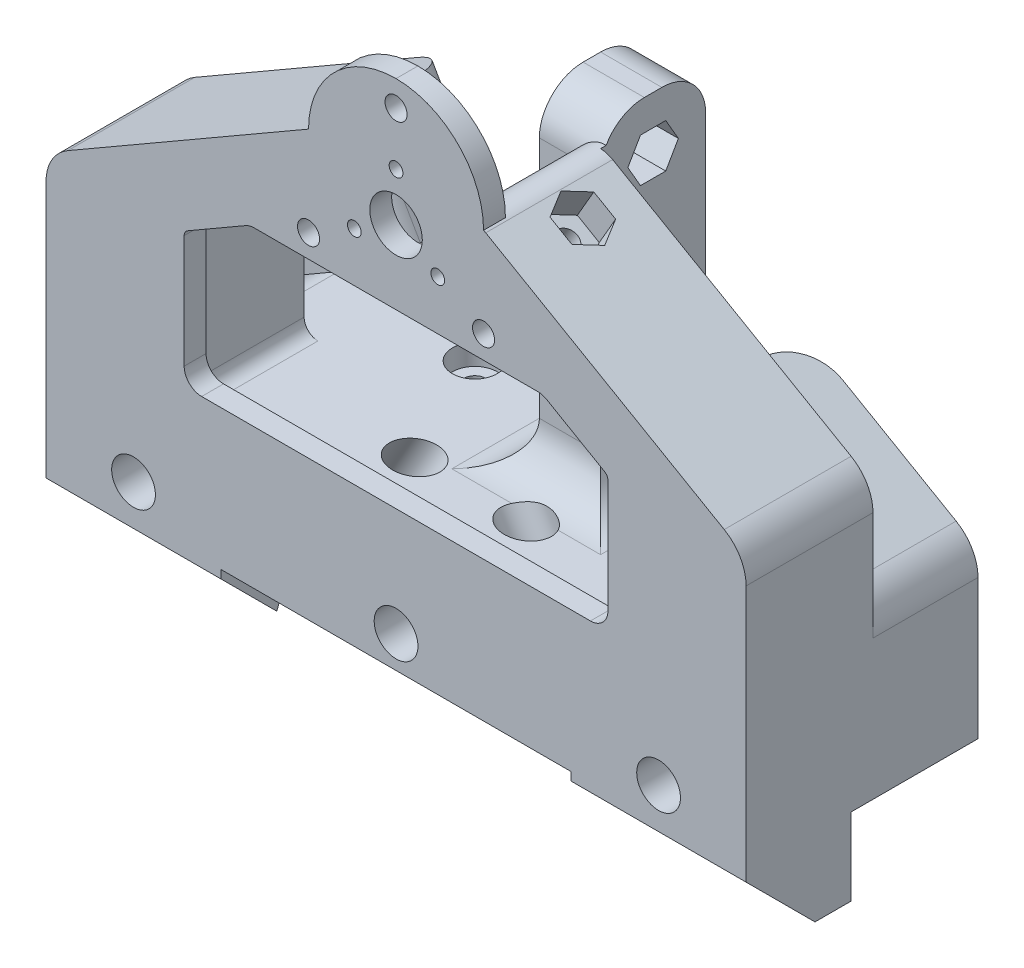
from build123d import *

# Parameters (mm, degrees)
BOSS_EXTRUDE1_DEPTH            = 15.239999999999998
SKETCH5_R                      = 1.5874999999999992
CUT_EXTRUDE2_DEPTH             = 8.89
SKETCH6_R                      = 1.5875000000000001
CUT_EXTRUDE3_DEPTH             = 8.89
CUT_EXTRUDE8_REACH             = 93.354
SKETCH11_R                     = 1.5874999999999977
SKETCH11_R_2                   = 1.5874999999999986
BOSS_EXTRUDE4_DEPTH            = 15.239999999999998
SKETCH8_R                      = 1.5874999999999986
CUT_EXTRUDE4_DEPTH             = 12.7
SKETCH9_R                      = 1.5874999999999986
CUT_EXTRUDE5_DEPTH             = 12.7
CUT_EXTRUDE9_DEPTH             = 4.7625
CUT_EXTRUDE10_DEPTH            = 4.7625
CUT_EXTRUDE11_DEPTH            = 4.7625
CUT_EXTRUDE13_DEPTH            = 4.7625
CUT_EXTRUDE16_DEPTH            = 4.7625
SKETCH23_R                     = 3.81
BOSS_EXTRUDE5_DEPTH            = 3.175
M3_CLEARANCE_HOLE1_D           = 3.2
M3_CLEARANCE_HOLE1_DEPTH       = 9.906
M3_CLEARANCE_HOLE1_TIP         = 0.9613769904440965
CUT_EXTRUDE18_REACH            = 132.345
SKETCH27_R                     = 0.9999999999999983
SKETCH27_R_2                   = 0.9999999999999831
SKETCH22_R                     = 3.1749999999999976
SKETCH22_R_2                   = 3.175000000000005
SKETCH22_R_3                   = 3.1750000000000016
CUT_EXTRUDE17_DEPTH            = 131.34523000436675
CBORE_FOR_M3_SHCS1_D           = 3.2
CBORE_FOR_M3_SHCS1_CBORE_D     = 6.5
CBORE_FOR_M3_SHCS1_CBORE_DEPTH = 3
SKETCH31_W                     = 25.39999999999999
SKETCH31_H                     = 15.239999999999995
BOSS_EXTRUDE7_DEPTH            = 11.2
FILLET10_R                     = 2
FILLET11_R                     = 6.35
SKETCH33_R                     = 3.174999999999998
CUT_EXTRUDE19_DEPTH            = 106.4973216137225
SKETCH34_R                     = 3.174999999999998
CUT_EXTRUDE20_DEPTH            = 131.17236791631467
FILLET12_R                     = 12.7
FILLET13_R                     = 3.8099999999999996
CUT_EXTRUDE21_DEPTH            = 130.56176274652648
FILLET14_R                     = 2.54
CHAMFER1_SIZE                  = 10


# Some blends are built 0.0001 mm under size
with BuildPart() as part:
    # Sketch1 → Boss-Extrude1 (new body)
    with BuildSketch(Plane.XY):
        Polygon((0, 0), (101.6, 0), (101.6, 23.933700924276287), (76.48131233866454, 38.43598200723823), (72.03631233866459, 30.737016167594547), (95.25, 17.334587347438838), (62.07125, 17.33458734743884), (62.07124999999999, 65.2726752401245), (53.18125, 65.2726752401245), (53.18125, 17.334587347438838), (6.3500000000000005, 17.33458734743884), (29.563687661335408, 30.737016167594543), (25.11868766133546, 38.43598200723823), (0, 23.933700924276277), align=None)
    extrude(amount=BOSS_EXTRUDE1_DEPTH)

    # Sketch5 → Cut-Extrude2 (cut)
    with BuildSketch(Plane(origin=(35.76359650350056, 61.94436620545653, 0), x_dir=(0, 0, -1), z_dir=(0.49999999999999467, 0.8660254037844418, 0))):
        with Locations(Location((-7.619999999999999, -54.63676839643705, 0), (0, 0, 90))):
            Circle(SKETCH5_R)
    extrude(amount=-CUT_EXTRUDE2_DEPTH, mode=Mode.SUBTRACT)

    # Sketch6 → Cut-Extrude3 (cut)
    with BuildSketch(Plane(origin=(-10.363596503501109, 17.950275693207338, 0), x_dir=(0, 0, 1), z_dir=(-0.4999999999999948, 0.8660254037844417, 0))):
        with Locations(Location((7.62, 33.35141262806222, 0), (0, 0, 270))):
            Circle(SKETCH6_R)
    extrude(amount=-CUT_EXTRUDE3_DEPTH, mode=Mode.SUBTRACT)

    # Sketch11 → Cut-Extrude8 (cut, up to next)
    with BuildSketch(Plane.ZY.offset(-62.07125), mode=Mode.PRIVATE) as cut_extrude8_sk1:
        with Locations(Location((7.619999999999999, 57.6526752401245, 0), (0, 0, 180))):
            Circle(SKETCH11_R)
    cut_extrude8_tool1 = extrude(cut_extrude8_sk1.sketch, amount=CUT_EXTRUDE8_REACH, mode=Mode.PRIVATE) & part.part
    # Sketch11 → Cut-Extrude8 (cut, up to next)
    with BuildSketch(Plane.ZY.offset(-62.07125), mode=Mode.PRIVATE) as cut_extrude8_sk2:
        with Locations(Location((7.620000000000002, 39.36073736343884, 0), (0, 0, 180))):
            Circle(SKETCH11_R_2)
    cut_extrude8_tool2 = extrude(cut_extrude8_sk2.sketch, amount=CUT_EXTRUDE8_REACH, mode=Mode.PRIVATE) & part.part
    add(cut_extrude8_tool1.solids().sort_by_distance((62.07125, 57.652675, 7.62))[0], mode=Mode.SUBTRACT)
    add(cut_extrude8_tool2.solids().sort_by_distance((62.07125, 39.360737, 7.62))[0], mode=Mode.SUBTRACT)

    # Sketch7 → Boss-Extrude4 (add)
    with BuildSketch(Plane.XY.offset(15.239999999999998)):
        Polygon((0, 0), (101.60000000000016, 1.244e-14), (101.60000000000042, 39.69825002449879), (60.514647953095114, 63.418889088530136), (56.069647953095114, 55.71992324888648), (82.55000000000042, 40.43148486636964), (82.55000000000037, 17.334587347438845), (50.80000000000008, 17.334587347438838), (19.050000000000004, 17.334587347438838), (19.050000000000004, 40.43148486636963), (45.5303520469053, 55.71992324888648), (41.0853520469053, 63.418889088530136), (0, 39.698250024498776), align=None)
    extrude(amount=BOSS_EXTRUDE4_DEPTH)

    # Sketch8 → Cut-Extrude4 (cut)
    with BuildSketch(Plane(origin=(-12.744846503501098, 22.074721678730434, 0), x_dir=(0, 0, -1), z_dir=(0.5000000000000002, -0.8660254037844385, 0))):
        with Locations(Location((-22.86, 59.67040314031204, 0), (0, 0, 90))):
            Circle(SKETCH8_R)
    extrude(amount=-CUT_EXTRUDE4_DEPTH, mode=Mode.SUBTRACT)

    # Sketch9 → Cut-Extrude5 (cut)
    with BuildSketch(Plane(origin=(38.14484650350119, 66.06881219098013, 0), x_dir=(0, 0, 1), z_dir=(-0.5, -0.8660254037844387, 0))):
        with Locations(Location((22.86, -28.31777788418729, 0), (0, 0, 270))):
            Circle(SKETCH9_R)
    extrude(amount=-CUT_EXTRUDE5_DEPTH, mode=Mode.SUBTRACT)

    # Sketch15 → Cut-Extrude9 (cut)
    with BuildSketch(Plane(origin=(42.58984650350124, 73.76777803062379, 0), x_dir=(0, 0, -1), z_dir=(0.5000000000000004, 0.8660254037844385, 0))):
        Polygon((-19.685, -26.48469077951019), (-19.685, -30.150864988864313), (-22.86, -31.983952093541372), (-26.035000000000004, -30.15086498886431), (-26.035000000000004, -26.48469077951019), (-22.86, -24.651603674833126), align=None)
    extrude(amount=-CUT_EXTRUDE9_DEPTH, mode=Mode.SUBTRACT)

    # Sketch16 → Cut-Extrude10 (cut)
    with BuildSketch(Plane(origin=(31.31859650350064, 54.24540036581284, 0), x_dir=(0, 0, -1), z_dir=(0.4999999999999949, 0.8660254037844417, 0))):
        Polygon((-4.445000000000004, -52.803681291759986), (-4.445000000000004, -56.46985550111411), (-7.619999999999999, -58.30294260579117), (-10.794999999999996, -56.46985550111411), (-10.794999999999996, -52.803681291759986), (-7.619999999999999, -50.97059418708293), align=None)
    extrude(amount=CUT_EXTRUDE10_DEPTH, mode=Mode.SUBTRACT)

    # Sketch17 → Cut-Extrude11 (cut)
    with BuildSketch(Plane(origin=(-5.9185965035011545, 10.251309853563654, 18.861690463744978), x_dir=(-0.2961981327260284, -0.17101007166283463, 0.9396926207859069), z_dir=(-0.4999999999999949, 0.8660254037844417, 0))):
        Polygon((-18.795588501103953, 29.32827886042014), (-18.795588501103953, 25.66210465106602), (-21.97058850110395, 23.82901754638896), (-25.145588501103948, 25.66210465106602), (-25.145588501103948, 29.32827886042014), (-21.97058850110395, 31.161365965097204), align=None)
    extrude(amount=CUT_EXTRUDE11_DEPTH, mode=Mode.SUBTRACT)

    # Sketch20 → Cut-Extrude13 (cut)
    with BuildSketch(Plane(origin=(62.07125, 8.98e-15, -63.5), x_dir=(0, 0, 1), z_dir=(-1, -1.4e-16, 0))):
        Polygon((74.78617420935413, 39.36073736343885), (72.95308710467704, 36.18573736343886), (69.28691289532296, 36.18573736343886), (67.45382579064588, 39.36073736343884), (69.28691289532291, 42.53573736343882), (72.95308710467704, 42.53573736343882), align=None)
        Polygon((74.78617420935413, 57.652675240124516), (72.95308710467704, 54.477675240124526), (69.28691289532296, 54.477675240124526), (67.45382579064588, 57.6526752401245), (69.28691289532291, 60.827675240124485), (72.95308710467704, 60.827675240124485), align=None)
    extrude(amount=CUT_EXTRUDE13_DEPTH, mode=Mode.SUBTRACT)

    # Sketch21 → Cut-Extrude16 (cut)
    with BuildSketch(Plane(origin=(-66.09980165744878, 1.5355117441898172, 0), x_dir=(0.8660254037844384, 0.5000000000000006, 0), z_dir=(0.5000000000000006, -0.8660254037844384, 0))):
        Polygon((119.32175468868053, 24.693087104677048), (119.32175468868053, 21.02691289532295), (116.14675468868049, 19.193825790645906), (112.97175468868052, 21.02691289532295), (112.97175468868052, 24.693087104677048), (116.14675468868049, 26.526174209354096), align=None)
    extrude(amount=CUT_EXTRUDE16_DEPTH, mode=Mode.SUBTRACT)

    # Sketch23 → Boss-Extrude5 (add)
    with BuildSketch(Plane.XY.offset(30.479999999999997)):
        Polygon((38.10000000000023, 61.69529528062369), (0, 39.69825002449881), (0, 7.78e-15), (101.6, 1.244e-14), (101.60000000000016, 39.69825002449895), (63.50000000000022, 61.695295280623654), (63.500000000000206, 74.3952952806237), (38.10000000000022, 74.39529528062369), align=None)
        with Locations((50.80000000000019, 56.01272525612479)):
            Circle(SKETCH23_R, mode=Mode.SUBTRACT)
    extrude(amount=BOSS_EXTRUDE5_DEPTH)

    # M3 Clearance Hole1
    with Locations(Plane.XY.offset(33.654999999999994)):
        with Locations((38.1, 48.680376837), (63.5, 48.680376837), (50.8, 70.677422094)):
            Hole(M3_CLEARANCE_HOLE1_D / 2, depth=M3_CLEARANCE_HOLE1_DEPTH)
            with Locations((0, 0, -(M3_CLEARANCE_HOLE1_DEPTH + M3_CLEARANCE_HOLE1_TIP / 2))):  # 118° drill point
                Cone(0, M3_CLEARANCE_HOLE1_D / 2, M3_CLEARANCE_HOLE1_TIP, mode=Mode.SUBTRACT)

    # Sketch27 → Cut-Extrude18 (cut, up to next)
    with BuildSketch(Plane.XY.offset(33.654999999999994), mode=Mode.PRIVATE) as cut_extrude18_sk1:
        with Locations((44.750812554565925, 52.52022525612478)):
            Circle(SKETCH27_R)
    cut_extrude18_tool1 = extrude(cut_extrude18_sk1.sketch, amount=-CUT_EXTRUDE18_REACH, mode=Mode.PRIVATE) & part.part
    # Sketch27 → Cut-Extrude18 (cut, up to next)
    with BuildSketch(Plane.XY.offset(33.654999999999994), mode=Mode.PRIVATE) as cut_extrude18_sk2:
        with Locations((56.849187445434474, 52.520225256124796)):
            Circle(SKETCH27_R_2)
    cut_extrude18_tool2 = extrude(cut_extrude18_sk2.sketch, amount=-CUT_EXTRUDE18_REACH, mode=Mode.PRIVATE) & part.part
    # Sketch27 → Cut-Extrude18 (cut, up to next)
    with BuildSketch(Plane.XY.offset(33.654999999999994), mode=Mode.PRIVATE) as cut_extrude18_sk3:
        with Locations((50.8000000000002, 62.99772525612477)):
            Circle(SKETCH27_R)
    cut_extrude18_tool3 = extrude(cut_extrude18_sk3.sketch, amount=-CUT_EXTRUDE18_REACH, mode=Mode.PRIVATE) & part.part
    add(cut_extrude18_tool1.solids().sort_by_distance((44.750813, 52.520225, 33.655))[0], mode=Mode.SUBTRACT)
    add(cut_extrude18_tool2.solids().sort_by_distance((56.849187, 52.520225, 33.655))[0], mode=Mode.SUBTRACT)
    add(cut_extrude18_tool3.solids().sort_by_distance((50.8, 62.997725, 33.655))[0], mode=Mode.SUBTRACT)

    # Sketch22 → Cut-Extrude17 (cut, through all)
    with BuildSketch(Plane(origin=(0, 0, 0), x_dir=(-1, 0, 0), z_dir=(0, 0, -1))):
        with Locations((-88.9, 4.634587347438833)):
            Circle(SKETCH22_R)
        with Locations((-50.8, 4.6345873474388375)):
            Circle(SKETCH22_R_2)
        with Locations((-12.699999999999989, 4.6345873474388375)):
            Circle(SKETCH22_R_3)
    extrude(amount=-CUT_EXTRUDE17_DEPTH, mode=Mode.SUBTRACT)

    # CBORE for M3 SHCS1 (through all)
    with Locations(Plane(origin=(-15.72574093086107, 17.334587347438827, 0.8913153010314027), x_dir=(1, -7e-17, 0), z_dir=(7e-17, 1, 0))):
        with Locations((82.400740931, -5.458684699), (50.650740931, -5.458684699)):
            CounterBoreHole(CBORE_FOR_M3_SHCS1_D / 2, CBORE_FOR_M3_SHCS1_CBORE_D / 2, CBORE_FOR_M3_SHCS1_CBORE_DEPTH)

    # Sketch31 → Boss-Extrude7 (add)
    with BuildSketch(Plane.XZ):
        Polygon((0, 33.654999999999994), (25.4, 33.654999999999994), (25.4, 18.415), (1.56e-15, 18.415), align=None)
        with Locations((88.89999999999998, 26.034999999999997)):
            Rectangle(SKETCH31_W, SKETCH31_H)
    extrude(amount=BOSS_EXTRUDE7_DEPTH)

    # Fillet10
    fillet10_edges = [part.edges().sort_by_distance(p)[0] for p in [
        (82.55000000000042, 40.43148486636964, 22.86),
        (19.050000000000004, 40.43148486636963, 22.86),
        (50.80000000000018, 17.33458734743884, 30.479999999999997),
        (19.050000000000004, 17.334587347438838, 22.86),
        (82.55000000000037, 17.334587347438845, 22.86),
        (95.25, 17.334587347438838, 7.619999999999999),
        (6.3500000000000005, 17.33458734743884, 7.619999999999999),
    ]]
    fillet(fillet10_edges, radius=FILLET10_R)

    # Fillet11
    # the kernel refuses this fillet: 6.35 mm, written as the material it adds along each edge
    with BuildSketch(Plane(origin=(62.07125, 17.33458734743884, 15.239999999999998), x_dir=(0, 0, 1), z_dir=(-1, -1.1e-16, 0))) as fillet11_piece_1:
        with BuildLine():
            CenterArc((FILLET11_R, FILLET11_R), FILLET11_R, 180.00000000000003, 90)
            Line((-1.78e-15, FILLET11_R), (-FILLET11_R * 0.02, FILLET11_R))
            Line((-FILLET11_R * 0.02, FILLET11_R), (-FILLET11_R * 0.02, -FILLET11_R * 0.02))
            Line((-FILLET11_R * 0.02, -FILLET11_R * 0.02), (FILLET11_R, -FILLET11_R * 0.02))
            Line((FILLET11_R, -FILLET11_R * 0.02), (FILLET11_R, 0))
        make_face()
    extrude(amount=8.89)
    with BuildSketch(Plane(origin=(53.18125, 17.334587347438838, 0), x_dir=(-1, 5.6e-16, 0), z_dir=(0, 0, 1))) as fillet11_piece_2:
        with BuildLine():
            CenterArc((FILLET11_R, -FILLET11_R), FILLET11_R, 90.00000000000004, 89.99999999999993)
            Line((3.55e-15, -FILLET11_R), (-FILLET11_R * 0.02, -FILLET11_R))
            Line((-FILLET11_R * 0.02, -FILLET11_R), (-FILLET11_R * 0.02, FILLET11_R * 0.02))
            Line((-FILLET11_R * 0.02, FILLET11_R * 0.02), (FILLET11_R, FILLET11_R * 0.02))
            Line((FILLET11_R, FILLET11_R * 0.02), (FILLET11_R, 0))
        make_face()
    extrude(amount=15.239999999999998)
    with BuildSketch(Plane(origin=(62.07125, 17.33458734743884, 0), x_dir=(1, 0, 0), z_dir=(0, 0, 1))) as fillet11_piece_3_section:
        with BuildLine():
            CenterArc((FILLET11_R, FILLET11_R), FILLET11_R, 180.00000000000003, 90)
            Line((0, FILLET11_R), (-FILLET11_R * 0.02, FILLET11_R))
            Line((-FILLET11_R * 0.02, FILLET11_R), (-FILLET11_R * 0.02, -FILLET11_R * 0.02))
            Line((-FILLET11_R * 0.02, -FILLET11_R * 0.02), (FILLET11_R, -FILLET11_R * 0.02))
            Line((FILLET11_R, -FILLET11_R * 0.02), (FILLET11_R, 0))
        make_face()
    fillet11_piece_3 = extrude(amount=15.239999999999998, mode=Mode.PRIVATE)
    fillet11_piece_3 = fillet11_piece_3 - Plane(origin=(66.67500000013894, 18.910593055756184, 6.350000000031403), x_dir=(1, -7e-17, 0), z_dir=(7e-17, 1, 0)) * Cylinder(3.25, 56, mode=Mode.PRIVATE)
    add(fillet11_piece_3)
    with BuildSketch(Plane(origin=(77.94624999999999, 17.33458734743884, 15.239999999999998), x_dir=(0, 0, 1), z_dir=(-1, -1.1e-16, 0))) as fillet11_piece_4a_section:
        with BuildLine():
            CenterArc((FILLET11_R, FILLET11_R), FILLET11_R, 180.00000000000003, 90)
            Line((-1.78e-15, FILLET11_R), (-FILLET11_R * 0.02, FILLET11_R))
            Line((-FILLET11_R * 0.02, FILLET11_R), (-FILLET11_R * 0.02, -FILLET11_R * 0.02))
            Line((-FILLET11_R * 0.02, -FILLET11_R * 0.02), (FILLET11_R, -FILLET11_R * 0.02))
            Line((FILLET11_R, -FILLET11_R * 0.02), (FILLET11_R, 0))
        make_face()
    fillet11_piece_4a = extrude(amount=24.764999999999993, mode=Mode.PRIVATE)
    fillet11_piece_4a = split(fillet11_piece_4a, bisect_by=Plane(origin=(62.07125, 18.77219632303319, 16.677608975594335), z_dir=(1, 1.5e-16, 0)), keep=Keep.TOP, mode=Mode.PRIVATE)
    with BuildSketch(Plane(origin=(62.07125, 17.33458734743884, 0), x_dir=(1, 0, 0), z_dir=(0, 0, 1))) as fillet11_piece_4b_section:
        with BuildLine():
            CenterArc((FILLET11_R, FILLET11_R), FILLET11_R, 180.00000000000003, 90)
            Line((0, FILLET11_R), (-FILLET11_R * 0.02, FILLET11_R))
            Line((-FILLET11_R * 0.02, FILLET11_R), (-FILLET11_R * 0.02, -FILLET11_R * 0.02))
            Line((-FILLET11_R * 0.02, -FILLET11_R * 0.02), (FILLET11_R, -FILLET11_R * 0.02))
            Line((FILLET11_R, -FILLET11_R * 0.02), (FILLET11_R, 0))
        make_face()
    fillet11_piece_4b = extrude(amount=31.115000000000002, mode=Mode.PRIVATE)
    fillet11_piece_4b = split(fillet11_piece_4b, bisect_by=Plane(origin=(63.50885897559436, 18.772196323033185, 15.239999999999998), z_dir=(0, 0, 1)), keep=Keep.TOP, mode=Mode.PRIVATE)
    fillet11_piece_4 = fillet11_piece_4a & fillet11_piece_4b
    add(fillet11_piece_4)
    with BuildSketch(Plane(origin=(53.18125, 17.334587347438838, 0), x_dir=(-1, 5.6e-16, 0), z_dir=(0, 0, 1))) as fillet11_piece_5a_section:
        with BuildLine():
            CenterArc((FILLET11_R, -FILLET11_R), FILLET11_R, 90.00000000000004, 89.99999999999993)
            Line((3.55e-15, -FILLET11_R), (-FILLET11_R * 0.02, -FILLET11_R))
            Line((-FILLET11_R * 0.02, -FILLET11_R), (-FILLET11_R * 0.02, FILLET11_R * 0.02))
            Line((-FILLET11_R * 0.02, FILLET11_R * 0.02), (FILLET11_R, FILLET11_R * 0.02))
            Line((FILLET11_R, FILLET11_R * 0.02), (FILLET11_R, 0))
        make_face()
    fillet11_piece_5a = extrude(amount=31.115000000000002, mode=Mode.PRIVATE)
    fillet11_piece_5a = split(fillet11_piece_5a, bisect_by=Plane(origin=(51.74364102440566, 18.772196323033185, 15.239999999999998), z_dir=(0, 0, 1)), keep=Keep.TOP, mode=Mode.PRIVATE)
    with BuildSketch(Plane(origin=(62.07125, 17.33458734743884, 15.239999999999998), x_dir=(0, 0, 1), z_dir=(-1, -1.1e-16, 0))) as fillet11_piece_5b_section:
        with BuildLine():
            CenterArc((FILLET11_R, FILLET11_R), FILLET11_R, 180.00000000000003, 90)
            Line((-1.78e-15, FILLET11_R), (-FILLET11_R * 0.02, FILLET11_R))
            Line((-FILLET11_R * 0.02, FILLET11_R), (-FILLET11_R * 0.02, -FILLET11_R * 0.02))
            Line((-FILLET11_R * 0.02, -FILLET11_R * 0.02), (FILLET11_R, -FILLET11_R * 0.02))
            Line((FILLET11_R, -FILLET11_R * 0.02), (FILLET11_R, 0))
        make_face()
    fillet11_piece_5b = extrude(amount=24.764999999999993, mode=Mode.PRIVATE)
    fillet11_piece_5b = split(fillet11_piece_5b, bisect_by=Plane(origin=(53.18125, 18.772196323033185, 16.67760897559434), z_dir=(-1, 0, 0)), keep=Keep.TOP, mode=Mode.PRIVATE)
    fillet11_piece_5 = fillet11_piece_5a & fillet11_piece_5b
    add(fillet11_piece_5)
    # the kernel refuses this fillet: 6.35 mm, written as the material it takes off along each edge
    with BuildSketch(Plane(origin=(45.5303520469053, 55.71992324888648, 15.239999999999998), x_dir=(-0.8660254037844384, -0.5000000000000003, 0), z_dir=(-0.5000000000000003, 0.8660254037844386, 0))) as fillet11_2_piece_1:
        with BuildLine():
            CenterArc((FILLET11_R, FILLET11_R), FILLET11_R, 180, 90)
            Line((-1.78e-15, FILLET11_R), (-FILLET11_R * 0.02, FILLET11_R))
            Line((-FILLET11_R * 0.02, FILLET11_R), (-FILLET11_R * 0.02, -FILLET11_R * 0.02))
            Line((-FILLET11_R * 0.02, -FILLET11_R * 0.02), (FILLET11_R, -FILLET11_R * 0.02))
            Line((FILLET11_R, -FILLET11_R * 0.02), (FILLET11_R, 0))
        make_face()
    extrude(amount=8.889999999999997, mode=Mode.SUBTRACT)
    with BuildSketch(Plane(origin=(76.48131233866454, 38.43598200723823, 15.239999999999998), x_dir=(0, 0, -1), z_dir=(-0.4999999999999947, -0.8660254037844418, 0))) as fillet11_2_piece_2:
        with BuildLine():
            CenterArc((FILLET11_R, FILLET11_R), FILLET11_R, 180, 90)
            Line((-1.78e-15, FILLET11_R), (-FILLET11_R * 0.02, FILLET11_R))
            Line((-FILLET11_R * 0.02, FILLET11_R), (-FILLET11_R * 0.02, -FILLET11_R * 0.02))
            Line((-FILLET11_R * 0.02, -FILLET11_R * 0.02), (FILLET11_R, -FILLET11_R * 0.02))
            Line((FILLET11_R, -FILLET11_R * 0.02), (FILLET11_R, 0))
        make_face()
    extrude(amount=8.889999999999997, mode=Mode.SUBTRACT)
    with BuildSketch(Plane(origin=(29.563687661335408, 30.737016167594543, 15.239999999999998), x_dir=(0, 0, -1), z_dir=(-0.4999999999999942, 0.866025403784442, 0))) as fillet11_2_piece_3:
        with BuildLine():
            CenterArc((FILLET11_R, FILLET11_R), FILLET11_R, 180.00000000000003, 90)
            Line((-1.78e-15, FILLET11_R), (-FILLET11_R * 0.02, FILLET11_R))
            Line((-FILLET11_R * 0.02, FILLET11_R), (-FILLET11_R * 0.02, -FILLET11_R * 0.02))
            Line((-FILLET11_R * 0.02, -FILLET11_R * 0.02), (FILLET11_R, -FILLET11_R * 0.02))
            Line((FILLET11_R, -FILLET11_R * 0.02), (FILLET11_R, 0))
        make_face()
    extrude(amount=8.889999999999997, mode=Mode.SUBTRACT)
    with BuildSketch(Plane(origin=(29.563687661335408, 30.737016167594543, 0), x_dir=(0, 0, 1), z_dir=(-0.4999999999999942, 0.866025403784442, 0))) as fillet11_2_piece_4:
        with BuildLine():
            CenterArc((FILLET11_R, -FILLET11_R), FILLET11_R, 90, 89.99999999999997)
            Line((-8.9e-16, -FILLET11_R), (-FILLET11_R * 0.02, -FILLET11_R))
            Line((-FILLET11_R * 0.02, -FILLET11_R), (-FILLET11_R * 0.02, FILLET11_R * 0.02))
            Line((-FILLET11_R * 0.02, FILLET11_R * 0.02), (FILLET11_R, FILLET11_R * 0.02))
            Line((FILLET11_R, FILLET11_R * 0.02), (FILLET11_R, 0))
        make_face()
    extrude(amount=8.889999999999997, mode=Mode.SUBTRACT)
    with BuildSketch(Plane(origin=(76.48131233866454, 38.43598200723823, 0), x_dir=(0, 0, 1), z_dir=(-0.4999999999999947, -0.8660254037844418, 0))) as fillet11_2_piece_5:
        with BuildLine():
            CenterArc((FILLET11_R, -FILLET11_R), FILLET11_R, 90, 90)
            Line((-8.9e-16, -FILLET11_R), (-FILLET11_R * 0.02, -FILLET11_R))
            Line((-FILLET11_R * 0.02, -FILLET11_R), (-FILLET11_R * 0.02, FILLET11_R * 0.02))
            Line((-FILLET11_R * 0.02, FILLET11_R * 0.02), (FILLET11_R, FILLET11_R * 0.02))
            Line((FILLET11_R, FILLET11_R * 0.02), (FILLET11_R, 0))
        make_face()
    extrude(amount=8.889999999999997, mode=Mode.SUBTRACT)
    with BuildSketch(Plane(origin=(101.60000000000042, 39.69825002449879, 15.239999999999998), x_dir=(-0.8660254037844375, 0.5000000000000022, -1.627396157507454e-14), z_dir=(-1.389e-14, 8.49e-15, 1))) as fillet11_2_piece_6:
        with BuildLine():
            CenterArc((FILLET11_R * 0.57735026919, FILLET11_R), FILLET11_R, 210.0000000000002, 60)
            Line((-FILLET11_R * 0.288675134595, FILLET11_R * 0.5), (-FILLET11_R * 0.305995642671, FILLET11_R * 0.49))
            Line((-FILLET11_R * 0.305995642671, FILLET11_R * 0.49), (-FILLET11_R * 0.0115470053838, -FILLET11_R * 0.02))
            Line((-FILLET11_R * 0.0115470053838, -FILLET11_R * 0.02), (FILLET11_R * 0.57735026919, -FILLET11_R * 0.02))
            Line((FILLET11_R * 0.57735026919, -FILLET11_R * 0.02), (FILLET11_R * 0.57735026919, 1.2e-16))
        make_face()
    extrude(amount=18.414999999999996, mode=Mode.SUBTRACT)
    with BuildSketch(Plane(origin=(101.6, 23.933700924276287, 0), x_dir=(-0.8660254037844423, 0.4999999999999938, 0), z_dir=(0, 0, 1))) as fillet11_2_piece_7:
        with BuildLine():
            CenterArc((FILLET11_R * 0.57735026919, FILLET11_R), FILLET11_R, 209.99999999999952, 60.0000000000004)
            Line((-FILLET11_R * 0.288675134595, FILLET11_R * 0.5), (-FILLET11_R * 0.30599564267, FILLET11_R * 0.49))
            Line((-FILLET11_R * 0.30599564267, FILLET11_R * 0.49), (-FILLET11_R * 0.0115470053838, -FILLET11_R * 0.02))
            Line((-FILLET11_R * 0.0115470053838, -FILLET11_R * 0.02), (FILLET11_R * 0.57735026919, -FILLET11_R * 0.02))
            Line((FILLET11_R * 0.57735026919, -FILLET11_R * 0.02), (FILLET11_R * 0.57735026919, 2e-17))
        make_face()
    extrude(amount=15.239999999999998, mode=Mode.SUBTRACT)
    with BuildSketch(Plane(origin=(0, 23.933700924276277, 0), x_dir=(0.8660254037844417, 0.4999999999999948, 0), z_dir=(0, 0, 1))) as fillet11_2_piece_8:
        with BuildLine():
            CenterArc((FILLET11_R * 0.57735026919, -FILLET11_R), FILLET11_R, 89.99999999999999, 60.000000000000384)
            Line((-FILLET11_R * 0.288675134595, -FILLET11_R * 0.5), (-FILLET11_R * 0.305995642671, -FILLET11_R * 0.49))
            Line((-FILLET11_R * 0.305995642671, -FILLET11_R * 0.49), (-FILLET11_R * 0.0115470053838, FILLET11_R * 0.02))
            Line((-FILLET11_R * 0.0115470053838, FILLET11_R * 0.02), (FILLET11_R * 0.57735026919, FILLET11_R * 0.02))
            Line((FILLET11_R * 0.57735026919, FILLET11_R * 0.02), (FILLET11_R * 0.57735026919, 1.3e-16))
        make_face()
    extrude(amount=15.239999999999998, mode=Mode.SUBTRACT)
    with BuildSketch(Plane(origin=(0, 39.69825002449881, 33.654999999999994), x_dir=(0.8660254037844423, 0.4999999999999938, 0), z_dir=(0, -1.93e-15, -1))) as fillet11_2_piece_9:
        with BuildLine():
            CenterArc((FILLET11_R * 0.57735026919, FILLET11_R), FILLET11_R, 209.9999999999998, 59.999999999999716)
            Line((-FILLET11_R * 0.288675134595, FILLET11_R * 0.5), (-FILLET11_R * 0.30599564267, FILLET11_R * 0.49))
            Line((-FILLET11_R * 0.30599564267, FILLET11_R * 0.49), (-FILLET11_R * 0.0115470053838, -FILLET11_R * 0.02))
            Line((-FILLET11_R * 0.0115470053838, -FILLET11_R * 0.02), (FILLET11_R * 0.57735026919, -FILLET11_R * 0.02))
            Line((FILLET11_R * 0.57735026919, -FILLET11_R * 0.02), (FILLET11_R * 0.57735026919, 5e-17))
        make_face()
    extrude(amount=18.414999999999996, mode=Mode.SUBTRACT)
    with BuildSketch(Plane(origin=(62.07124999999999, 65.2726752401245, 15.239999999999998), x_dir=(0, -1, 0), z_dir=(-1, 0, 0))) as fillet11_2_piece_10_section:
        with BuildLine():
            CenterArc((FILLET11_R, -FILLET11_R), FILLET11_R, 90, 90)
            Line((0, -FILLET11_R), (-FILLET11_R * 0.02, -FILLET11_R))
            Line((-FILLET11_R * 0.02, -FILLET11_R), (-FILLET11_R * 0.02, FILLET11_R * 0.02))
            Line((-FILLET11_R * 0.02, FILLET11_R * 0.02), (FILLET11_R, FILLET11_R * 0.02))
            Line((FILLET11_R, FILLET11_R * 0.02), (FILLET11_R, 0))
        make_face()
    fillet11_2_piece_10 = extrude(amount=8.889999999999993, mode=Mode.PRIVATE)
    fillet11_2_piece_10 = split(fillet11_2_piece_10, bisect_by=Plane(origin=(61.11156527313953, 64.45278021476493, 13.74111960618633), z_dir=(0.8660254037844387, -0.5000000000000003, 0)), keep=Keep.TOP, mode=Mode.PRIVATE)
    fillet11_2_piece_10 = split(fillet11_2_piece_10, bisect_by=Plane(origin=(60.97046730003426, 63.15572166587298, 13.74111960618633), z_dir=(0.5000000000000004, 0.8660254037844385, 0)), keep=Keep.TOP, mode=Mode.PRIVATE)
    add(fillet11_2_piece_10, mode=Mode.SUBTRACT)
    with BuildSketch(Plane(origin=(62.07124999999999, 65.2726752401245, 15.239999999999998), x_dir=(0, -1, 0), z_dir=(-1, 0, 0))) as fillet11_2_piece_11_section:
        with BuildLine():
            CenterArc((FILLET11_R, -FILLET11_R), FILLET11_R, 90, 90)
            Line((0, -FILLET11_R), (-FILLET11_R * 0.02, -FILLET11_R))
            Line((-FILLET11_R * 0.02, -FILLET11_R), (-FILLET11_R * 0.02, FILLET11_R * 0.02))
            Line((-FILLET11_R * 0.02, FILLET11_R * 0.02), (FILLET11_R, FILLET11_R * 0.02))
            Line((FILLET11_R, FILLET11_R * 0.02), (FILLET11_R, 0))
        make_face()
    fillet11_2_piece_11 = extrude(amount=8.889999999999993, mode=Mode.PRIVATE)
    fillet11_2_piece_11 = split(fillet11_2_piece_11, bisect_by=Plane(origin=(60.93331882659865, 64.14404831308751, 13.043766637271109), z_dir=(-0.8660254037844387, 0.5000000000000003, 0)), keep=Keep.TOP, mode=Mode.PRIVATE)
    fillet11_2_piece_11 = split(fillet11_2_piece_11, bisect_by=Plane(origin=(59.258635332500496, 64.14404831313601, 13.043766637271109), z_dir=(0.5000000000000004, 0.8660254037844385, 0)), keep=Keep.TOP, mode=Mode.PRIVATE)
    add(fillet11_2_piece_11, mode=Mode.SUBTRACT)
    with BuildSketch(Plane(origin=(62.07124999999999, 65.2726752401245, 15.239999999999998), x_dir=(0, -1, 0), z_dir=(-1, 0, 0))) as fillet11_2_piece_12_section:
        with BuildLine():
            CenterArc((FILLET11_R, -FILLET11_R), FILLET11_R, 90, 90)
            Line((0, -FILLET11_R), (-FILLET11_R * 0.02, -FILLET11_R))
            Line((-FILLET11_R * 0.02, -FILLET11_R), (-FILLET11_R * 0.02, FILLET11_R * 0.02))
            Line((-FILLET11_R * 0.02, FILLET11_R * 0.02), (FILLET11_R, FILLET11_R * 0.02))
            Line((FILLET11_R, FILLET11_R * 0.02), (FILLET11_R, 0))
        make_face()
    fillet11_2_piece_12 = extrude(amount=8.889999999999993, mode=Mode.PRIVATE)
    fillet11_2_piece_12 = split(fillet11_2_piece_12, bisect_by=Plane(origin=(59.530986221783294, 61.715136992436896, 13.941728419206664), z_dir=(-0.8660254037844387, 0.5000000000000003, 0)), keep=Keep.TOP, mode=Mode.PRIVATE)
    fillet11_2_piece_12 = split(fillet11_2_piece_12, bisect_by=Plane(origin=(57.10765314605843, 65.38591845750042, 13.941728419206664), z_dir=(-0.5000000000000004, -0.8660254037844385, 0)), keep=Keep.TOP, mode=Mode.PRIVATE)
    add(fillet11_2_piece_12, mode=Mode.SUBTRACT)
    with BuildSketch(Plane(origin=(62.07124999999999, 65.2726752401245, 0), x_dir=(0, 0, 1), z_dir=(-1, 0, 0))) as fillet11_2_piece_13:
        with BuildLine():
            CenterArc((FILLET11_R, -FILLET11_R), FILLET11_R, 90, 90)
            Line((-8.9e-16, -FILLET11_R), (-FILLET11_R * 0.02, -FILLET11_R))
            Line((-FILLET11_R * 0.02, -FILLET11_R), (-FILLET11_R * 0.02, FILLET11_R * 0.02))
            Line((-FILLET11_R * 0.02, FILLET11_R * 0.02), (FILLET11_R, FILLET11_R * 0.02))
            Line((FILLET11_R, FILLET11_R * 0.02), (FILLET11_R, 0))
        make_face()
    extrude(amount=8.889999999999993, mode=Mode.SUBTRACT)

    # Sketch33 → Cut-Extrude19 (cut, through all)
    with BuildSketch(Plane(origin=(38.144846503501185, 66.06881219098011, 0), x_dir=(0.8660254037844386, -0.4999999999999999, 0), z_dir=(-0.49999999999999994, -0.8660254037844387, 0))):
        with Locations((28.3177778841873, 22.86)):
            Circle(SKETCH33_R)
    extrude(amount=CUT_EXTRUDE19_DEPTH, mode=Mode.SUBTRACT)

    # Sketch34 → Cut-Extrude20 (cut, through all)
    with BuildSketch(Plane(origin=(-12.7448465035011, 22.074721678730437, 0), x_dir=(0.8660254037844385, 0.5000000000000004, 0), z_dir=(0.5000000000000003, -0.8660254037844384, 0))):
        with Locations(Location((59.670403140312054, 22.86, 0), (0, 0, 180))):
            Circle(SKETCH34_R)
    extrude(amount=CUT_EXTRUDE20_DEPTH, mode=Mode.SUBTRACT)

    # Fillet12
    fillet12_edges = [part.edges().sort_by_distance(p)[0] for p in [
        (38.10000000000022, 74.39529528062369, 32.067499999999995),
        (63.500000000000206, 74.3952952806237, 32.067499999999995),
    ]]
    fillet(fillet12_edges, radius=FILLET12_R - 0.0001)  # a hair under: the kernel refuses the full size

    # Fillet13
    fillet13_edges = [part.edges().sort_by_distance(p)[0] for p in [
        (56.069647953095114, 55.71992324888648, 22.86),
        (60.51464795309497, 63.41888908852985, 21.92701700648133),
    ]]
    fillet(fillet13_edges, radius=FILLET13_R)

    # Sketch35 → Cut-Extrude21 (cut, through all)
    with BuildSketch(Plane(origin=(0, 0, 30.479999999999997), x_dir=(-1, 0, 0), z_dir=(0, 0, -1))):
        with BuildLine():
            Line((-72.04913300152127, 45.33946271628679), (-29.550866998479155, 45.33946271628679))
            Line((-29.550866998479155, 45.33946271628679), (-20.55, 40.14280973177482))
            ThreePointArc((-20.55, 40.14280973177482), (-20.183974596215567, 39.77678432799038), (-20.050000000000004, 39.27678432799038))
            Line((-20.050000000000004, 39.27678432799038), (-20.050000000000004, 20.334587347438834))
            Line((-20.050000000000004, 20.334587347438834), (-81.55000000000042, 20.33458734743883))
            Line((-81.55000000000042, 20.33458734743883), (-81.55000000000042, 39.27678432799039))
            ThreePointArc((-81.55000000000042, 39.27678432799039), (-81.41602540378486, 39.77678432799039), (-81.05000000000042, 40.142809731774825))
            Line((-81.05000000000042, 40.142809731774825), (-72.04913300152127, 45.33946271628679))
        make_face()
    extrude(amount=-CUT_EXTRUDE21_DEPTH, mode=Mode.SUBTRACT)

    # Fillet14
    fillet14_edges = [part.edges().sort_by_distance(p)[0] for p in [
        (20.050000000000004, 20.334587347438834, 32.067499999999995),
        (81.55000000000042, 20.33458734743883, 32.067499999999995),
        (72.04913300152127, 45.33946271628679, 32.067499999999995),
        (29.550866998479155, 45.33946271628679, 32.067499999999995),
    ]]
    fillet(fillet14_edges, radius=FILLET14_R)

    # Chamfer1
    # the kernel refuses this chamfer: 10 mm, written as the material it takes off along each edge
    with BuildSketch(Plane(origin=(127.31682987965908, -11.200000000000003, 33.654999999999994), x_dir=(0, 0.9996219169112968, 0.027495876610586317), z_dir=(-1, 0, 0))) as chamfer1_piece_1:
        Polygon((CHAMFER1_SIZE * 0.999621916911, CHAMFER1_SIZE * 0.0274958766106), (-CHAMFER1_SIZE * 0.0274958766106, CHAMFER1_SIZE * 0.999621916911), (0, 0), align=None)
    extrude(amount=76.83365975931821, mode=Mode.SUBTRACT)
    with BuildSketch(Plane(origin=(-25.71682987965911, -11.200000000000003, 33.654999999999994), x_dir=(0, 0.9996219169112968, 0.027495876610586317), z_dir=(1, 0, 0))) as chamfer1_piece_2:
        Polygon((CHAMFER1_SIZE * 0.999621916911, -CHAMFER1_SIZE * 0.0274958766106), (-CHAMFER1_SIZE * 0.0274958766106, -CHAMFER1_SIZE * 0.999621916911), (0, 0), align=None)
    extrude(amount=76.8336597593182, mode=Mode.SUBTRACT)


solid = part.part
